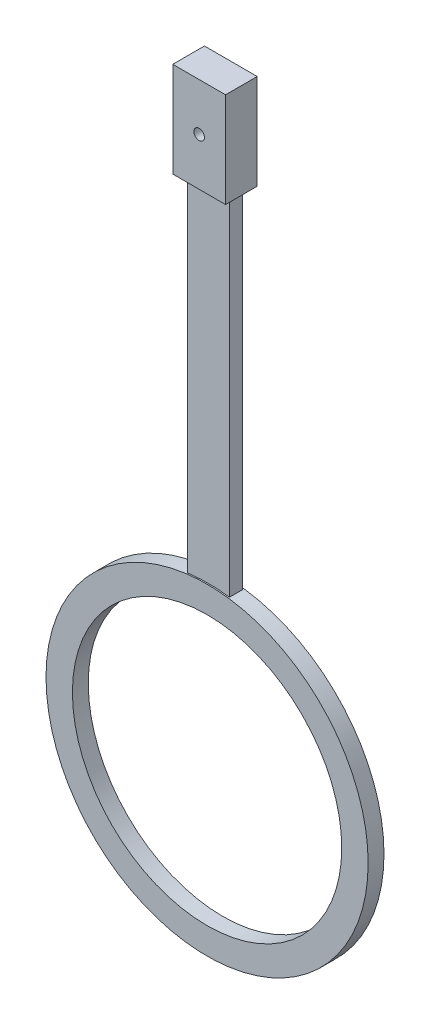
from build123d import *

# Parameters (mm, degrees)
SKETCH1_R           = 30.5
BOSS_EXTRUDE1_DEPTH = 1.5
SKETCH2_W           = 8
SKETCH2_H           = 71
BOSS_EXTRUDE2_DEPTH = 1.25
SKETCH3_W           = 10
SKETCH3_H           = 18
BOSS_EXTRUDE3_DEPTH = 3
SKETCH4_R           = 25.5
CUT_EXTRUDE1_DEPTH  = 10
SKETCH5_R           = 1
CUT_EXTRUDE2_DEPTH  = 10


with BuildPart() as part:
    # Sketch1 → Boss-Extrude1 (new, symmetric)
    with BuildSketch(Plane.XY):
        Circle(SKETCH1_R)
    extrude(amount=BOSS_EXTRUDE1_DEPTH, both=True)

    # Sketch2 → Boss-Extrude2 (add, symmetric)
    with BuildSketch(Plane.XY):
        with Locations((0, 60.5)):
            Rectangle(SKETCH2_W, SKETCH2_H)
    extrude(amount=BOSS_EXTRUDE2_DEPTH, both=True)

    # Sketch3 → Boss-Extrude3 (add, symmetric)
    with BuildSketch(Plane.XY):
        with Locations((0, 105)):
            Rectangle(SKETCH3_W, SKETCH3_H)
    extrude(amount=BOSS_EXTRUDE3_DEPTH, both=True)

    # Sketch4 → Cut-Extrude1 (cut, symmetric)
    with BuildSketch(Plane.XY):
        Circle(SKETCH4_R)
    extrude(amount=CUT_EXTRUDE1_DEPTH, both=True, mode=Mode.SUBTRACT)

    # Sketch5 → Cut-Extrude2 (cut, symmetric)
    with BuildSketch(Plane.XY):
        with Locations((0, 105)):
            Circle(SKETCH5_R)
    extrude(amount=CUT_EXTRUDE2_DEPTH, both=True, mode=Mode.SUBTRACT)


solid = part.part
